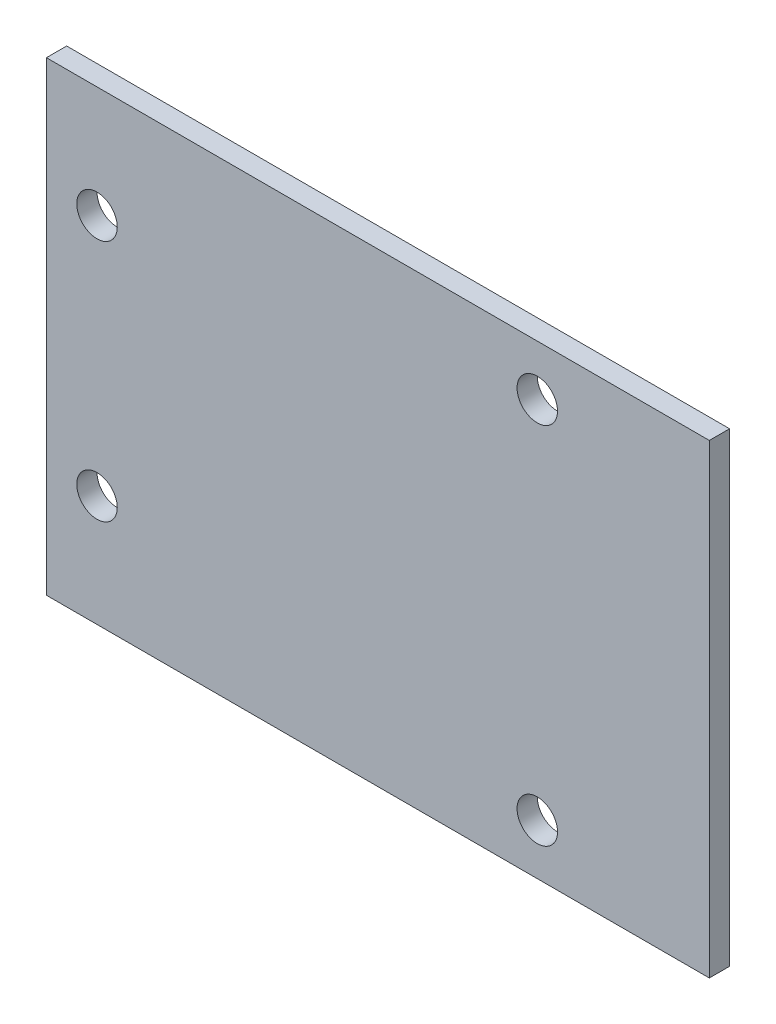
from build123d import *

# Parameters (mm, degrees)
ESQUISSE1_W             = 65.5
ESQUISSE1_H             = 46
BOSS_EXTRU_1_DEPTH      = 2
ESQUISSE2_R             = 2
ENL_V_MAT_EXTRU_1_DEPTH = 81.06403687


with BuildPart() as part:
    # Esquisse1 → Boss.-Extru.1 (new body)
    with BuildSketch(Plane.XY):
        with Locations((32.75, 23)):
            Rectangle(ESQUISSE1_W, ESQUISSE1_H)
    extrude(amount=BOSS_EXTRU_1_DEPTH)

    # Esquisse2 → Enlèv. mat.-Extru.1 (cut, through all)
    with BuildSketch(Plane.XY.offset(2)):
        with Locations((5, 11)):
            Circle(ESQUISSE2_R)
        with Locations((5, 35)):
            Circle(ESQUISSE2_R)
        with Locations((48.5, 41)):
            Circle(ESQUISSE2_R)
        with Locations((48.5, 5)):
            Circle(ESQUISSE2_R)
    extrude(amount=-ENL_V_MAT_EXTRU_1_DEPTH, mode=Mode.SUBTRACT)


solid = part.part
